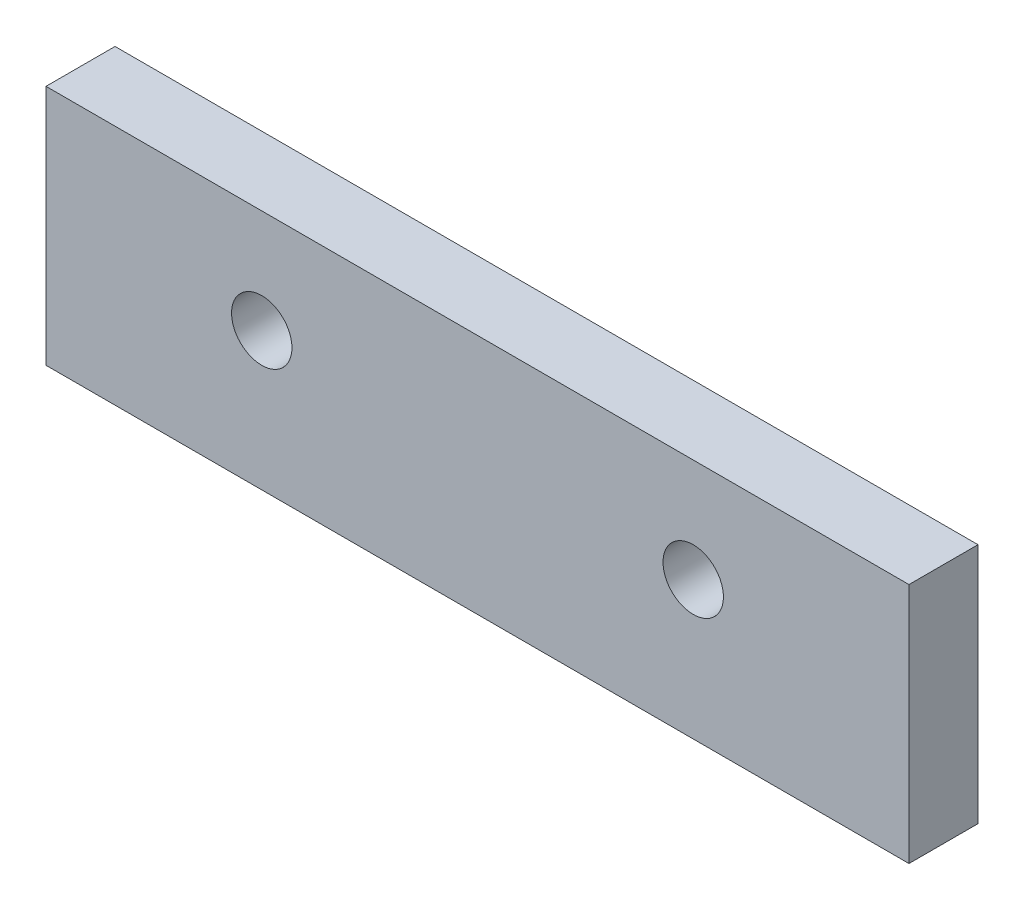
from build123d import *

# Parameters (mm, degrees)
SKETCH1_W           = 50
SKETCH1_H           = 14
SKETCH1_R           = 1.75
BOSS_EXTRUDE1_DEPTH = 4


with BuildPart() as part:
    # Sketch1 → Boss-Extrude1 (new body)
    with BuildSketch(Plane.XY):
        with Locations((25, 7)):
            Rectangle(SKETCH1_W, SKETCH1_H)
        with Locations((12.5, 8)):
            Circle(SKETCH1_R, mode=Mode.SUBTRACT)
        with Locations((37.5, 8)):
            Circle(SKETCH1_R, mode=Mode.SUBTRACT)
    extrude(amount=BOSS_EXTRUDE1_DEPTH)


solid = part.part
